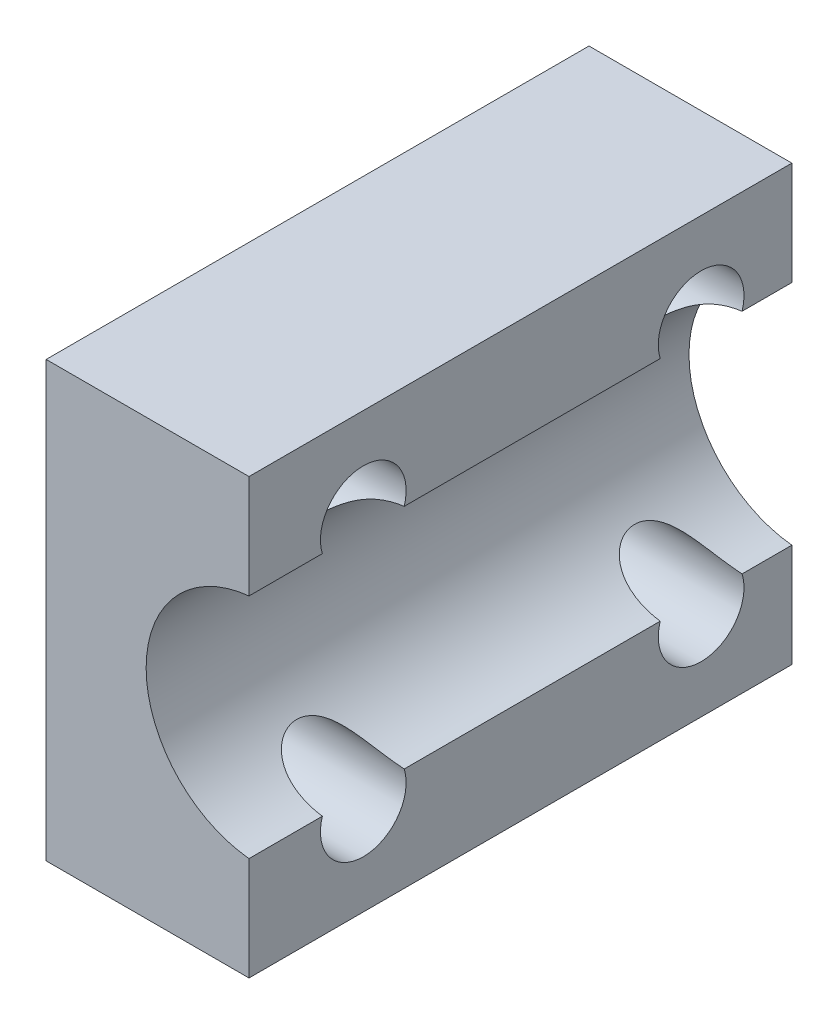
from build123d import *

# Parameters (mm, degrees)
EXTRUDE1_DEPTH = 19
SKETCH2_R      = 1.5
EXTRUDE5_DEPTH = 22.794724132
SKETCH3_W      = 0.4
SKETCH3_H      = 15.2
EXTRUDE6_DEPTH = 22.794724254


with BuildPart() as part:
    # Sketch1 → Extrude1 (new body)
    with BuildSketch(Plane.XY):
        with BuildLine():
            Line((0, 4), (0, 7.6))
            Line((0, 7.6), (-7.5, 7.6))
            Line((-7.5, 7.6), (-7.5, -7.6))
            Line((-7.5, -7.6), (0, -7.6))
            Line((0, -7.6), (0, -4))
            ThreePointArc((0, -4), (-4, 0), (0, 4))
        make_face()
    extrude(amount=EXTRUDE1_DEPTH)

    # Sketch2 → Extrude5 (cut, through all)
    with BuildSketch(Plane(origin=(-7.5, 0, 0), x_dir=(0, 0, -1), z_dir=(1, 0, 0))):
        with Locations((-3.175, 4.425)):
            Circle(SKETCH2_R)
        with Locations((-15, 4.425)):
            Circle(SKETCH2_R)
        with Locations((-15, -4.425)):
            Circle(SKETCH2_R)
        with Locations((-3.175, -4.425)):
            Circle(SKETCH2_R)
    extrude(amount=EXTRUDE5_DEPTH, mode=Mode.SUBTRACT)

    # Sketch3 → Extrude6 (cut, through all)
    with BuildSketch(Plane.XY.offset(19)):
        with Locations((-0.2, 0)):
            Rectangle(SKETCH3_W, SKETCH3_H)
    extrude(amount=-EXTRUDE6_DEPTH, mode=Mode.SUBTRACT)


solid = part.part
